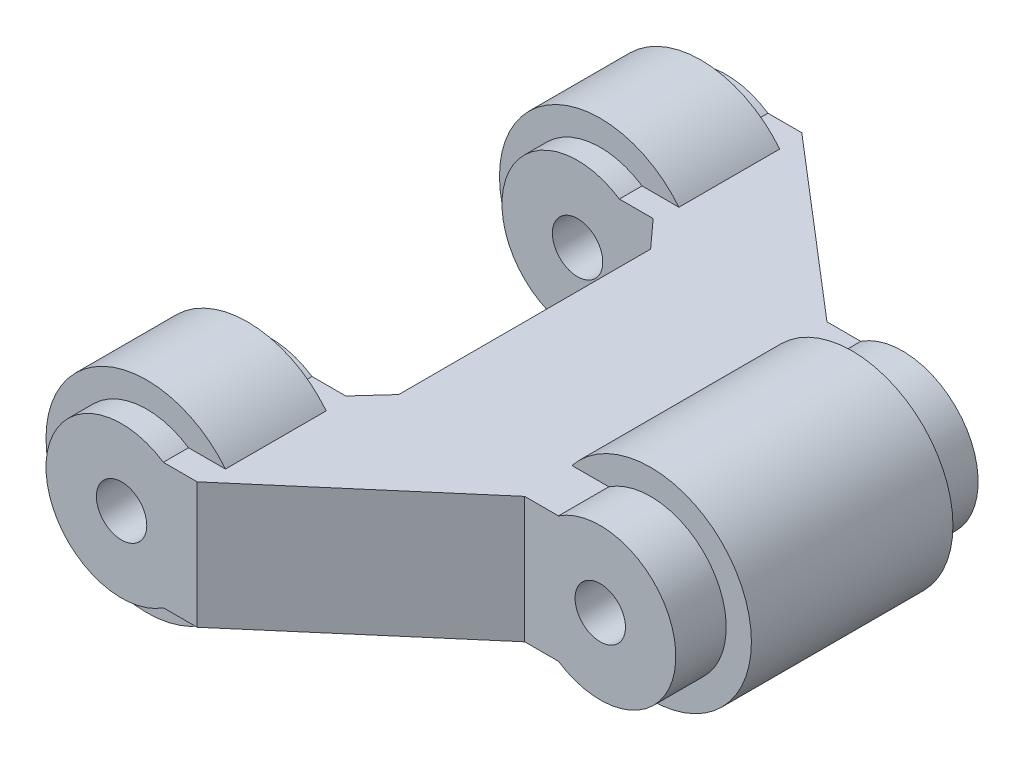
from build123d import *

# Parameters (mm, degrees)
SKETCH_1_R               = 3
SKETCH_1_R_2             = 1
EXTRUDE_1_DEPTH          = 6
SKETCH_1_4_R             = 4
SKETCH_1_4_R_2           = 3
EXTRUDE_2_DEPTH          = 4
SKETCH_1_5_R             = 3
SKETCH_1_5_R_2           = 1
EXTRUDE_3_DEPTH          = 12
SKETCH_2_R               = 4
SKETCH_2_R_2             = 3
EXTRUDE_4_DEPTH          = 2
CUT_EXTRUDE_1_DEPTH      = 17.439282223
CUT_EXTRUDE_1_DEPTH_BACK = 17.439282223
SKETCH_3_W               = 6
SKETCH_3_H               = 12.2
EXTRUDE_7_DEPTH          = 2.5


with BuildPart() as part:
    # Эскиз1 → Бобышка-Вытянуть1 (new, symmetric)
    with BuildSketch(Plane.XY):
        with Locations((6.5, 0)):
            Circle(SKETCH_1_R)
        with Locations((6.5, 0)):
            Circle(SKETCH_1_R_2, mode=Mode.SUBTRACT)
    extrude(amount=EXTRUDE_1_DEPTH, both=True)

    # Эскиз1<4> → Бобышка-Вытянуть2 (add, symmetric)
    with BuildSketch(Plane.XY):
        with Locations((6.5, 0)):
            Circle(SKETCH_1_4_R)
        with Locations((6.5, 0)):
            Circle(SKETCH_1_4_R_2, mode=Mode.SUBTRACT)
    extrude(amount=EXTRUDE_2_DEPTH, both=True)



with BuildPart() as body_2:
    # Эскиз1<5> → Бобышка-Вытянуть3 (new, symmetric)
    with BuildSketch(Plane.XY):
        with Locations((-6.5, 0)):
            Circle(SKETCH_1_5_R)
        with Locations((-6.5, 0)):
            Circle(SKETCH_1_5_R_2, mode=Mode.SUBTRACT)
    extrude(amount=EXTRUDE_3_DEPTH, both=True)

    # Эскиз2 → Бобышка-Вытянуть4 (add, symmetric)
    with BuildSketch(Plane.XY.offset(9)):
        with Locations((-6.5, 0)):
            Circle(SKETCH_2_R)
        with Locations((-6.5, 0)):
            Circle(SKETCH_2_R_2, mode=Mode.SUBTRACT)
    extrude_4 = extrude(amount=EXTRUDE_4_DEPTH, both=True)

    # Зеркальное отражение1: Бобышка-Вытянуть4 across plane
    add(extrude_4.mirror(Plane.XY))

    # Эскиз3 → Вырез-Вытянуть1 (cut, two sides: drawn at the far end of the back side and taken through both)
    with BuildSketch(Plane(origin=(0, 0, 0), x_dir=(1, 0, 0), z_dir=(0, 1, 0)).offset(-CUT_EXTRUDE_1_DEPTH_BACK)):
        with Locations((-6.5, 0)):
            Rectangle(SKETCH_3_W, SKETCH_3_H)
    extrude(amount=CUT_EXTRUDE_1_DEPTH + CUT_EXTRUDE_1_DEPTH_BACK, mode=Mode.SUBTRACT)


with BuildPart() as cut_extrude_1_piece_1:
    # of the separate pieces the step leaves, piece 1, a body of its own (cut_extrude_1_pieces)
    add(body_2.part.solids().sort_by_distance((-3.5, 0, -12))[0])


with BuildPart() as cut_extrude_1_piece_2:
    # of the separate pieces the step leaves, piece 2, a body of its own (cut_extrude_1_pieces)
    add(body_2.part.solids().sort_by_distance((-5.5, 0, 12))[0])


with BuildPart() as part_1:
    add(part.part)

    add(cut_extrude_1_piece_1.part)  # Бобышка-Вытянуть7 merges Вырез-Вытянуть1 piece 1

    add(cut_extrude_1_piece_2.part)  # Бобышка-Вытянуть7 merges Вырез-Вытянуть1 piece 2
    # Эскиз4 → Бобышка-Вытянуть7 (add, symmetric)
    with BuildSketch(Plane(origin=(0, 0, 0), x_dir=(1, 0, 0), z_dir=(0, 1, 0))):
        Polygon((5.5, -6), (5.5, 6), (3.5, 6), (-3.5, 12), (-5.5, 12), (-5.5, 6.1), (-3.5, 6.1), (-2.5, 5), (-2.5, -5), (-3.5, -6.1), (-5.5, -6.1), (-5.5, -12), (-3.5, -12), (3.5, -6), align=None)
    extrude(amount=EXTRUDE_7_DEPTH, both=True)


solid = part_1.part
